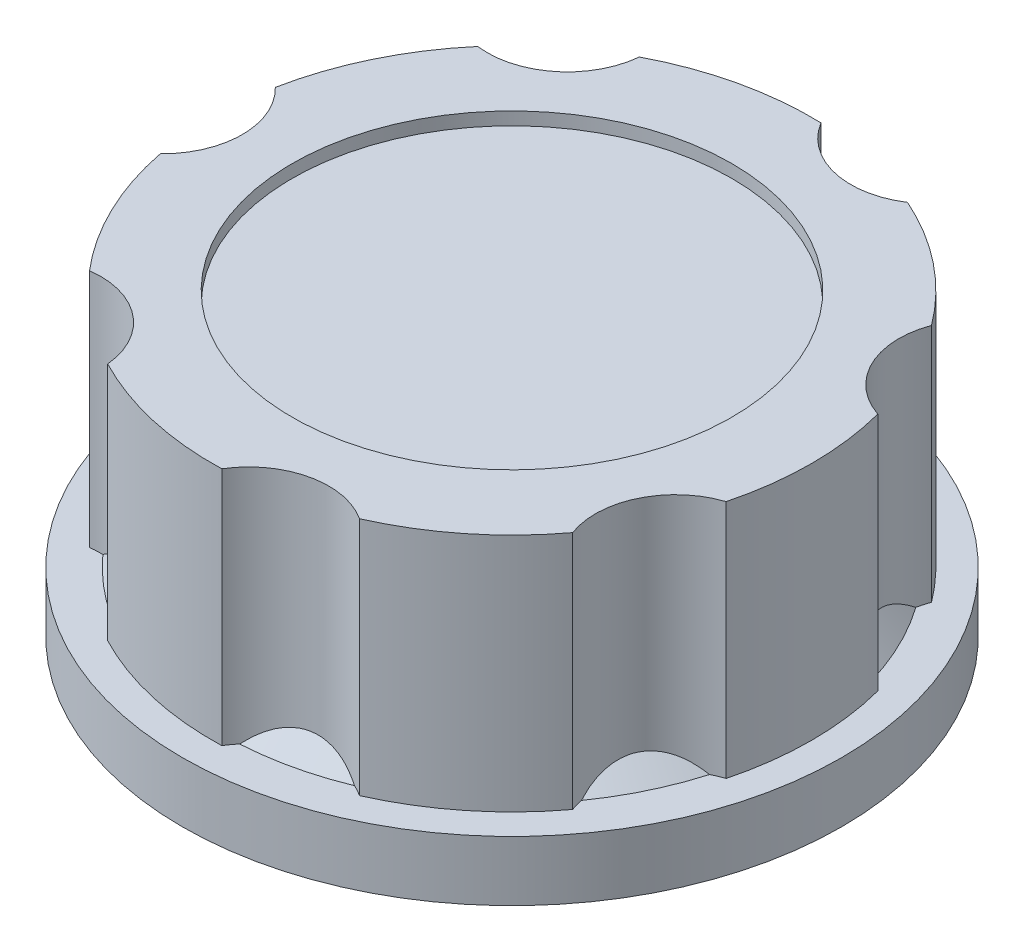
from build123d import *

# Parameters (mm, degrees)
SKETCH2_R          = 3.6
CUT_EXTRUDE1_DEPTH = 10
SKETCH3_R          = 4
CUT_EXTRUDE2_DEPTH = 11
CHAMFER1_SIZE      = 1.5


with BuildPart() as part:
    # Sketch1 → Revolve1 (revolve)
    with BuildSketch(Plane(origin=(0, 0, 0), x_dir=(0, 0, -1), z_dir=(1, 0, 0)), mode=Mode.PRIVATE) as revolve1_sk:
        Polygon((0, 0), (-16.5, 0), (-16.5, 3), (-15, 3), (-15, 15), (-11, 15), (-11, 14.355733533), (0, 14.355733533), align=None)
    revolve(revolve1_sk.sketch.rotate(Axis((0, 0, 0), (0, 1, 0)), 180), axis=Axis((0, 0, 0), (0, 1, 0)))

    # Sketch2 → Cut-Extrude1 (cut)
    with BuildSketch(Plane.XZ):
        with Locations(Location((0, 0, 0), (0, 0, 270))):
            Circle(SKETCH2_R)
    extrude(amount=-CUT_EXTRUDE1_DEPTH, mode=Mode.SUBTRACT)

    # Sketch3 → Cut-Extrude2 (cut)
    with BuildSketch(Plane(origin=(0, 15, 0), x_dir=(1, 0, 0), z_dir=(0, 1, 0))):
        with Locations((-17.5, 0)):
            Circle(SKETCH3_R)
        with Locations((-10.911071533, 13.682050943)):
            Circle(SKETCH3_R)
        with Locations((3.894116344, 17.061238463)):
            Circle(SKETCH3_R)
        with Locations((15.766955188, 7.592965435)):
            Circle(SKETCH3_R)
        with Locations((15.766955188, -7.592965435)):
            Circle(SKETCH3_R)
        with Locations((3.894116344, -17.061238463)):
            Circle(SKETCH3_R)
        with Locations((-10.911071533, -13.682050943)):
            Circle(SKETCH3_R)
    extrude(amount=-CUT_EXTRUDE2_DEPTH, mode=Mode.SUBTRACT)

    # Chamfer1
    # the kernel refuses this chamfer: 1.5 mm, written as the material it takes off along each edge
    with BuildSketch(Plane(origin=(0, 4, 0), x_dir=(-0.22388554303077474, 0, 0.974615443968448), z_dir=(-0.974615443968448, 0, -0.22388554303077474))) as chamfer1_piece_1_section:
        Polygon((15, -CHAMFER1_SIZE), (15 - CHAMFER1_SIZE, 0), (15, 0), align=None)
    chamfer1_piece_1 = revolve(axis=Axis((0, 4, 0), (0, 1, 0)), revolution_arc=51.588991206, mode=Mode.PRIVATE)
    chamfer1_piece_1 = split(chamfer1_piece_1, bisect_by=Plane(origin=(3.219301063, 3, 14.104691916), z_dir=(0, 1, 0)), keep=Keep.TOP, mode=Mode.PRIVATE)
    chamfer1_piece_1 = chamfer1_piece_1 & Plane(origin=(3.894116344, 3.575453248, 17.061238463), x_dir=(1, 0, 0), z_dir=(0, 1, 0)) * Cylinder(4, 60, mode=Mode.PRIVATE)
    add(chamfer1_piece_1, mode=Mode.SUBTRACT)
    with BuildSketch(Plane(origin=(0, 4, 0), x_dir=(-0.9015753902573829, 0, 0.43262202403743605), z_dir=(-0.43262202403743605, 0, -0.9015753902573829))) as chamfer1_piece_2_section:
        Polygon((15, -CHAMFER1_SIZE), (15 - CHAMFER1_SIZE, 0), (15, 0), align=None)
    chamfer1_piece_2 = revolve(axis=Axis((0, 4, 0), (0, 1, 0)), revolution_arc=51.588991206, mode=Mode.PRIVATE)
    chamfer1_piece_2 = split(chamfer1_piece_2, bisect_by=Plane(origin=(-9.020290662, 3, 11.311082492), z_dir=(0, 1, 0)), keep=Keep.TOP, mode=Mode.PRIVATE)
    chamfer1_piece_2 = chamfer1_piece_2 & Plane(origin=(-10.911071533, 3.575453183, 13.682050943), x_dir=(1, 0, 0), z_dir=(0, 1, 0)) * Cylinder(4, 60, mode=Mode.PRIVATE)
    add(chamfer1_piece_2, mode=Mode.SUBTRACT)
    with BuildSketch(Plane(origin=(0, 4, 0), x_dir=(-0.9003605798337992, 0, -0.4351446038747863), z_dir=(0.4351446038747863, 0, -0.9003605798337992))) as chamfer1_piece_3_section:
        Polygon((15, -CHAMFER1_SIZE), (15 - CHAMFER1_SIZE, 0), (15, 0), align=None)
    chamfer1_piece_3 = revolve(axis=Axis((0, 4, 0), (0, 1, 0)), revolution_arc=51.588991206, mode=Mode.PRIVATE)
    chamfer1_piece_3 = split(chamfer1_piece_3, bisect_by=Plane(origin=(-14.467418648, 3, -5.57e-07), z_dir=(0, 1, 0)), keep=Keep.TOP, mode=Mode.PRIVATE)
    chamfer1_piece_3 = chamfer1_piece_3 & Plane(origin=(-17.5, 3.575453666, 0), x_dir=(1, 0, 0), z_dir=(0, 1, 0)) * Cylinder(4, 60, mode=Mode.PRIVATE)
    add(chamfer1_piece_3, mode=Mode.SUBTRACT)
    with BuildSketch(Plane(origin=(0, 4, 0), x_dir=(-0.2211558887866005, 0, -0.9752384697370221), z_dir=(0.9752384697370221, 0, -0.2211558887866005))) as chamfer1_piece_4_section:
        Polygon((15, -CHAMFER1_SIZE), (15 - CHAMFER1_SIZE, 0), (15, 0), align=None)
    chamfer1_piece_4 = revolve(axis=Axis((0, 4, 0), (0, 1, 0)), revolution_arc=51.588991206, mode=Mode.PRIVATE)
    chamfer1_piece_4 = split(chamfer1_piece_4, bisect_by=Plane(origin=(-9.020286489, 3, -11.311086109), z_dir=(0, 1, 0)), keep=Keep.TOP, mode=Mode.PRIVATE)
    chamfer1_piece_4 = chamfer1_piece_4 & Plane(origin=(-10.911071533, 3.575453389, -13.682050943), x_dir=(1, 0, 0), z_dir=(0, 1, 0)) * Cylinder(4, 60, mode=Mode.PRIVATE)
    add(chamfer1_piece_4, mode=Mode.SUBTRACT)
    with BuildSketch(Plane(origin=(0, 4, 0), x_dir=(0.6245836972749009, 0, -0.7809578766479117), z_dir=(0.7809578766479117, 0, 0.6245836972749009))) as chamfer1_piece_5_section:
        Polygon((15, -CHAMFER1_SIZE), (15 - CHAMFER1_SIZE, 0), (15, 0), align=None)
    chamfer1_piece_5 = revolve(axis=Axis((0, 4, 0), (0, 1, 0)), revolution_arc=51.588991206, mode=Mode.PRIVATE)
    chamfer1_piece_5 = split(chamfer1_piece_5, bisect_by=Plane(origin=(3.219306774, 3, -14.104690845), z_dir=(0, 1, 0)), keep=Keep.TOP, mode=Mode.PRIVATE)
    chamfer1_piece_5 = chamfer1_piece_5 & Plane(origin=(3.894116344, 3.575453353, -17.061238463), x_dir=(1, 0, 0), z_dir=(0, 1, 0)) * Cylinder(4, 60, mode=Mode.PRIVATE)
    add(chamfer1_piece_5, mode=Mode.SUBTRACT)
    with BuildSketch(Plane(origin=(0, 4, 0), x_dir=(0.9999990201028447, 0, 0.001399926194576086), z_dir=(-0.001399926194576086, 0, 0.9999990201028447))) as chamfer1_piece_6_section:
        Polygon((15, -CHAMFER1_SIZE), (15 - CHAMFER1_SIZE, 0), (15, 0), align=None)
    chamfer1_piece_6 = revolve(axis=Axis((0, 4, 0), (0, 1, 0)), revolution_arc=51.588991206, mode=Mode.PRIVATE)
    chamfer1_piece_6 = split(chamfer1_piece_6, bisect_by=Plane(origin=(13.034696257, 3, -6.2771755), z_dir=(0, 1, 0)), keep=Keep.TOP, mode=Mode.PRIVATE)
    chamfer1_piece_6 = chamfer1_piece_6 & Plane(origin=(15.766955188, 3.575453245, -7.592965435), x_dir=(1, 0, 0), z_dir=(0, 1, 0)) * Cylinder(4, 60, mode=Mode.PRIVATE)
    add(chamfer1_piece_6, mode=Mode.SUBTRACT)
    with BuildSketch(Plane(origin=(0, 4, 0), x_dir=(0.622394684530797, 0, 0.782703556059259), z_dir=(-0.782703556059259, 0, 0.622394684530797))) as chamfer1_piece_7_section:
        Polygon((15, -CHAMFER1_SIZE), (15 - CHAMFER1_SIZE, 0), (15, 0), align=None)
    chamfer1_piece_7 = revolve(axis=Axis((0, 4, 0), (0, 1, 0)), revolution_arc=51.588991206, mode=Mode.PRIVATE)
    chamfer1_piece_7 = split(chamfer1_piece_7, bisect_by=Plane(origin=(13.03469369, 3, 6.277180857), z_dir=(0, 1, 0)), keep=Keep.TOP, mode=Mode.PRIVATE)
    chamfer1_piece_7 = chamfer1_piece_7 & Plane(origin=(15.766955188, 3.575453554, 7.592965435), x_dir=(1, 0, 0), z_dir=(0, 1, 0)) * Cylinder(4, 61, mode=Mode.PRIVATE)
    add(chamfer1_piece_7, mode=Mode.SUBTRACT)


solid = part.part
